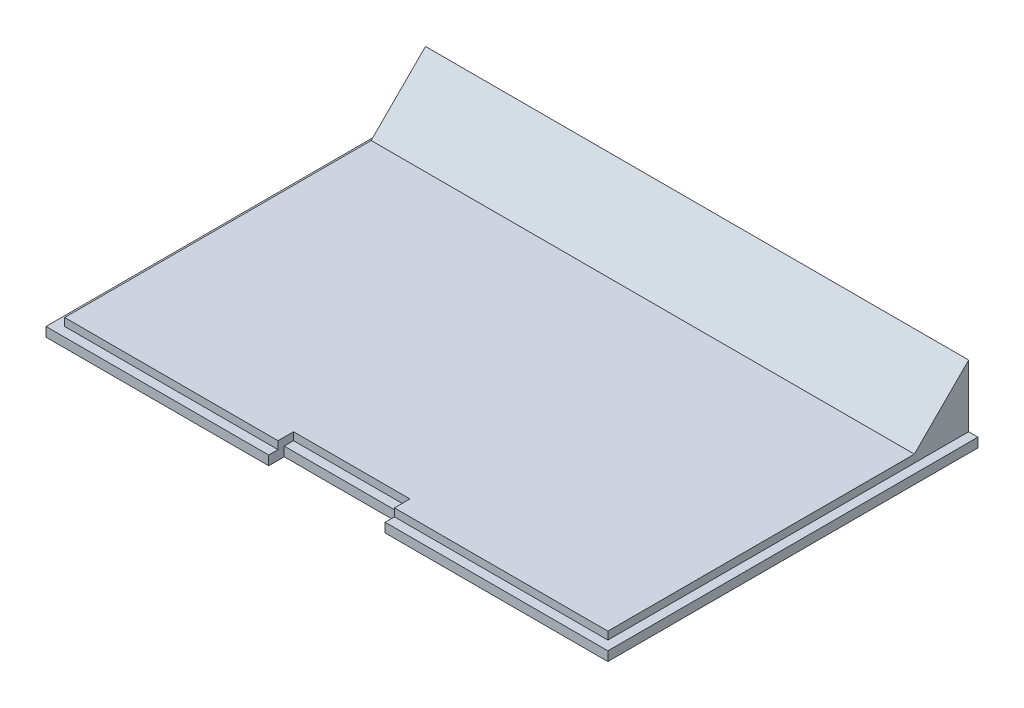
from build123d import *

# Parameters (mm, degrees)
SKICA2_W                 = 72.4
SKICA2_H                 = 47.7
P_IDAT_VYSUNUT_M1_DEPTH  = 1.2
SKICA3_W                 = 70
SKICA3_H                 = 46.5
P_IDAT_VYSUNUT_M2_DEPTH  = 1
SKICA4_W                 = 70
SKICA4_H                 = 7
P_IDAT_VYSUNUT_M3_DEPTH  = 7
ZKOSEN_2_SIZE            = 7
SKICA5_W                 = 15
SKICA5_H                 = 2
ODEBRAT_VYSUNUT_M1_DEPTH = 10
SKICA6_W                 = 15
SKICA6_H                 = 1.2
ODEBRAT_VYSUNUT_M2_DEPTH = 1


with BuildPart() as part:
    # Skica2 → Přidat vysunutím1 (new body)
    with BuildSketch(Plane(origin=(0, 0, 0), x_dir=(1, 0, 0), z_dir=(0, 1, 0))):
        with Locations((36.2, 23.85)):
            Rectangle(SKICA2_W, SKICA2_H)
    extrude(amount=P_IDAT_VYSUNUT_M1_DEPTH)

    # Skica3 → Přidat vysunutím2 (add)
    with BuildSketch(Plane(origin=(0, 1.2, 0), x_dir=(1, 0, 0), z_dir=(0, 1, 0))):
        with Locations((36.2, 24.45)):
            Rectangle(SKICA3_W, SKICA3_H)
    extrude(amount=P_IDAT_VYSUNUT_M2_DEPTH)

    # Skica4 → Přidat vysunutím3 (add)
    with BuildSketch(Plane(origin=(0, 2.2, 0), x_dir=(1, 0, 0), z_dir=(0, 1, 0))):
        with Locations((36.2, 44.2)):
            Rectangle(SKICA4_W, SKICA4_H)
    extrude(amount=P_IDAT_VYSUNUT_M3_DEPTH)

    # Zkosení2
    zkosen_2_edges = [part.edges().sort_by_distance(p)[0] for p in [
        (36.2, 9.2, -40.7),
    ]]
    chamfer(zkosen_2_edges, length=ZKOSEN_2_SIZE - 0.0001)  # a hair under: the kernel refuses the full size

    # Skica5 → Odebrat vysunutím1 (cut)
    with BuildSketch(Plane(origin=(0, 2.2, 0), x_dir=(1, 0, 0), z_dir=(0, 1, 0))):
        with Locations((36.2, 1)):
            Rectangle(SKICA5_W, SKICA5_H)
    extrude(amount=-ODEBRAT_VYSUNUT_M1_DEPTH, mode=Mode.SUBTRACT)

    # Skica6 → Odebrat vysunutím2 (cut)
    with BuildSketch(Plane(origin=(0, 2.2, 0), x_dir=(1, 0, 0), z_dir=(0, 1, 0))):
        with Locations((36.2, 2.6)):
            Rectangle(SKICA6_W, SKICA6_H)
    extrude(amount=-ODEBRAT_VYSUNUT_M2_DEPTH, mode=Mode.SUBTRACT)


solid = part.part
